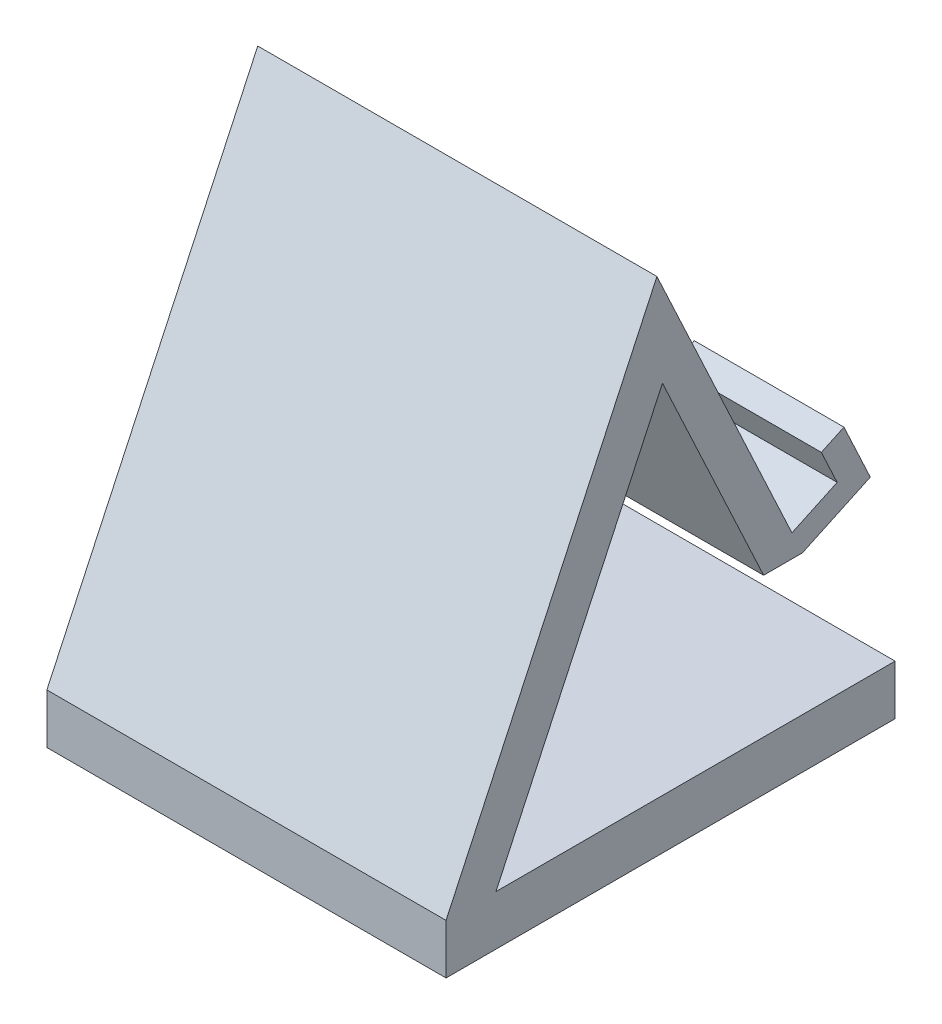
from build123d import *

# Parameters (mm, degrees)
BOSS_EXTRUDE1_DEPTH = 80
SKETCH2_W           = 30
SKETCH2_H           = 5
BOSS_EXTRUDE2_DEPTH = 10
SKETCH3_W           = 30
SKETCH3_H           = 12.5
BOSS_EXTRUDE3_DEPTH = 5


with BuildPart() as part:
    # Sketch1 → Boss-Extrude1 (new body)
    with BuildSketch(Plane(origin=(0, 0, 0), x_dir=(0, 0, -1), z_dir=(1, 0, 0))):
        Polygon((0, 10), (42.261826174, 100.630778704), (46.074889763, 92.453637449), (71.431985467, 38.075170227), (63.645988922, 38.075170227), (43.368827902, 81.559682364), (10, 10), (90, 10), (90, 0), (0, 0), align=None)
    extrude(amount=BOSS_EXTRUDE1_DEPTH)

    # Sketch2 → Boss-Extrude2 (add)
    with BuildSketch(Plane(origin=(0, 34.160499048, -73.257426617), x_dir=(-1, 0, 0), z_dir=(0, 0.4226182617406983, -0.9063077870366506))):
        with Locations((-65, 6.819361739)):
            Rectangle(SKETCH2_W, SKETCH2_H)
        with Locations((-15, 6.819361739)):
            Rectangle(SKETCH2_W, SKETCH2_H)
    extrude(amount=BOSS_EXTRUDE2_DEPTH)

    # Sketch3 → Boss-Extrude3 (add)
    with BuildSketch(Plane(origin=(0, 38.386681666, -82.320504487), x_dir=(-1, 0, 0), z_dir=(0, 0.42261826174069766, -0.9063077870366507))):
        with Locations((-65, 10.569361739)):
            Rectangle(SKETCH3_W, SKETCH3_H)
        with Locations((-15, 10.569361739)):
            Rectangle(SKETCH3_W, SKETCH3_H)
    extrude(amount=BOSS_EXTRUDE3_DEPTH)


solid = part.part
